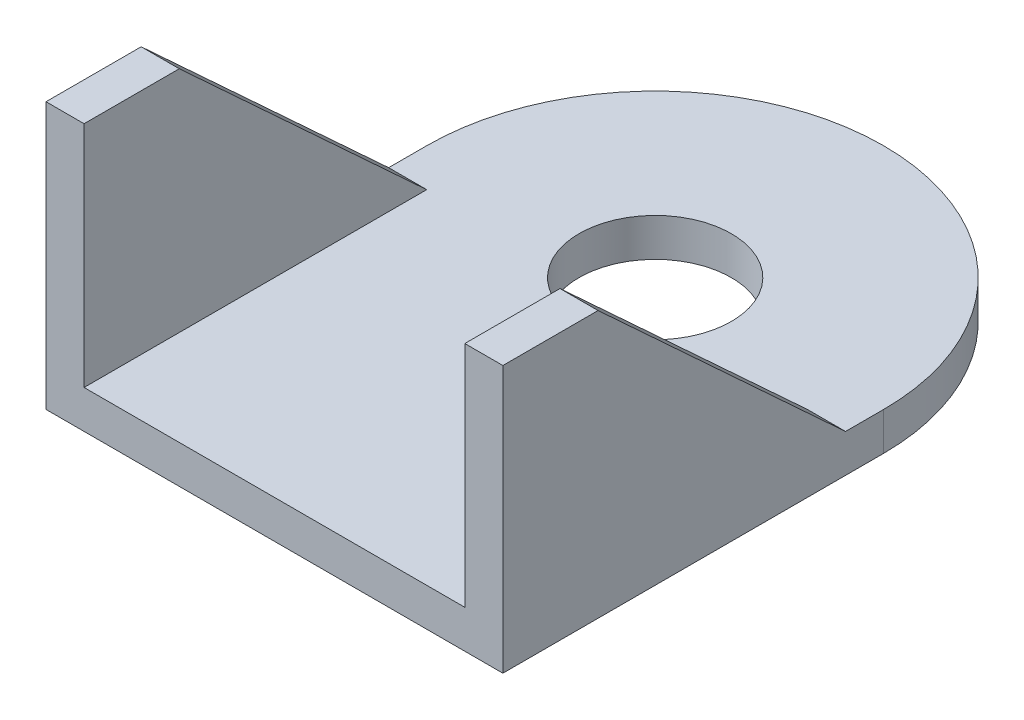
from build123d import *

# Parameters (mm, degrees)
SKETCH_1_R      = 4
EXTRUDE_1_DEPTH = 2
EXTRUDE_2_DEPTH = 2


with BuildPart() as part:
    # 草图1 → 凸台-拉伸1 (new body)
    with BuildSketch(Plane(origin=(0, 0, 0), x_dir=(1, 0, 0), z_dir=(0, 1, 0))):
        with BuildLine():
            Line((12, -20), (12, 0))
            ThreePointArc((12, 0), (0, 12), (-12, 0))
            Line((-12, 0), (-12, -20))
            Line((-12, -20), (12, -20))
        make_face()
        Circle(SKETCH_1_R, mode=Mode.SUBTRACT)
    extrude(amount=EXTRUDE_1_DEPTH)

    # 草图3 → 凸台-拉伸2 (add)
    with BuildSketch(Plane(origin=(12, 0, 0), x_dir=(0, 0, -1), z_dir=(1, 0, 0))):
        Polygon((-20, 2), (-20, 14), (-15, 14), (-2, 2), align=None)
    extrude_2 = extrude(amount=-EXTRUDE_2_DEPTH)

    # 镜向1: 凸台-拉伸2 across plane
    add(extrude_2.mirror(Plane(origin=(0, 0, 0), x_dir=(0, 0, 1), z_dir=(1, 0, 0))))


solid = part.part
